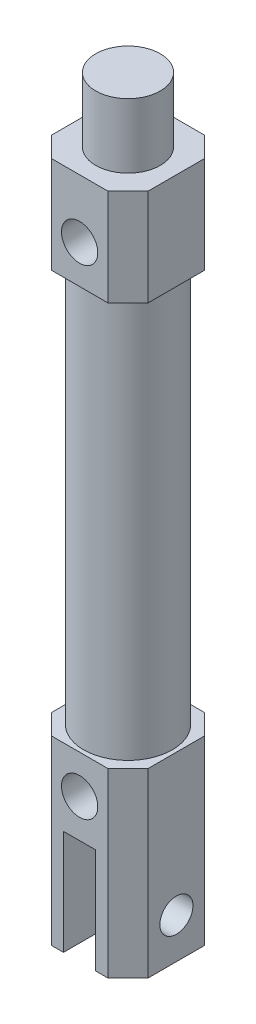
from build123d import *

# Parameters (mm, degrees)
SKETCH1_W           = 11.999999876
SKETCH1_H           = 11.999999876
BOSS_EXTRUDE1_DEPTH = 22.499999958
SKETCH2_R           = 5.499999922
BOSS_EXTRUDE2_DEPTH = 50.000000076
SKETCH3_W           = 11.999999876
SKETCH3_H           = 11.999999876
BOSS_EXTRUDE3_DEPTH = 11.999999876
SKETCH4_R           = 4.000000128
BOSS_EXTRUDE4_DEPTH = 8.000000002
CHAMFER1_SIZE       = 2.50000008
CHAMFER2_SIZE       = 2.50000008
SKETCH5_W           = 4.000000128
SKETCH5_H           = 12.999999908
CUT_EXTRUDE1_DEPTH  = 94.467908824
SKETCH6_R           = 2.049999964
CUT_EXTRUDE2_DEPTH  = 94.467908824
SKETCH7_R           = 2.250000072
CUT_EXTRUDE3_DEPTH  = 6.99999997
SKETCH8_R           = 2.250000072
CUT_EXTRUDE4_DEPTH  = 6.99999997


with BuildPart() as part:
    # Sketch1 → Boss-Extrude1 (new body)
    with BuildSketch(Plane(origin=(0, 0, 0), x_dir=(1, 0, 0), z_dir=(0, 1, 0))):
        Rectangle(SKETCH1_W, SKETCH1_H)
    extrude(amount=BOSS_EXTRUDE1_DEPTH)

    # Sketch2 → Boss-Extrude2 (add)
    with BuildSketch(Plane(origin=(0, 22.499999958, 0), x_dir=(1, 0, 0), z_dir=(0, 1, 0))):
        Circle(SKETCH2_R)
    extrude(amount=BOSS_EXTRUDE2_DEPTH)

    # Sketch3 → Boss-Extrude3 (add)
    with BuildSketch(Plane(origin=(0, 72.500000034, 0), x_dir=(1, 0, 0), z_dir=(0, 1, 0))):
        Rectangle(SKETCH3_W, SKETCH3_H)
    extrude(amount=BOSS_EXTRUDE3_DEPTH)

    # Sketch4 → Boss-Extrude4 (add)
    with BuildSketch(Plane(origin=(0, 84.49999991, 0), x_dir=(1, 0, 0), z_dir=(0, 1, 0))):
        Circle(SKETCH4_R)
    extrude(amount=BOSS_EXTRUDE4_DEPTH)

    # Chamfer1
    chamfer1_edges = [part.edges().sort_by_distance(p)[0] for p in [
        (-5.999999938, 11.249999979, 5.999999938),
        (-5.999999938, 11.249999979, -5.999999938),
        (5.999999938, 11.249999979, -5.999999938),
        (5.999999938, 11.249999979, 5.999999938),
    ]]
    chamfer(chamfer1_edges, length=CHAMFER1_SIZE)

    # Chamfer2
    chamfer2_edges = [part.edges().sort_by_distance(p)[0] for p in [
        (-5.999999938, 78.499999972, -5.999999938),
        (-5.999999938, 78.499999972, 5.999999938),
        (5.999999938, 78.499999972, 5.999999938),
        (5.999999938, 78.499999972, -5.999999938),
    ]]
    chamfer(chamfer2_edges, length=CHAMFER2_SIZE)

    # Sketch5 → Cut-Extrude1 (cut, through all)
    with BuildSketch(Plane.XY.offset(5.999999938)):
        with Locations((0, 6.499999954)):
            Rectangle(SKETCH5_W, SKETCH5_H)
    extrude(amount=-CUT_EXTRUDE1_DEPTH, mode=Mode.SUBTRACT)

    # Sketch6 → Cut-Extrude2 (cut, through all)
    with BuildSketch(Plane(origin=(5.999999938, 0, 0), x_dir=(0, 0, -1), z_dir=(1, 0, 0))):
        with Locations((0, 4.999999906)):
            Circle(SKETCH6_R)
    extrude(amount=-CUT_EXTRUDE2_DEPTH, mode=Mode.SUBTRACT)

    # Sketch7 → Cut-Extrude3 (cut)
    with BuildSketch(Plane.XY.offset(5.999999938)):
        with Locations((0, 17.749999806)):
            Circle(SKETCH7_R)
    extrude(amount=-CUT_EXTRUDE3_DEPTH, mode=Mode.SUBTRACT)

    # Sketch8 → Cut-Extrude4 (cut)
    with BuildSketch(Plane.XY.offset(5.999999938)):
        with Locations((0, 77.249999932)):
            Circle(SKETCH8_R)
    extrude(amount=-CUT_EXTRUDE4_DEPTH, mode=Mode.SUBTRACT)


solid = part.part
